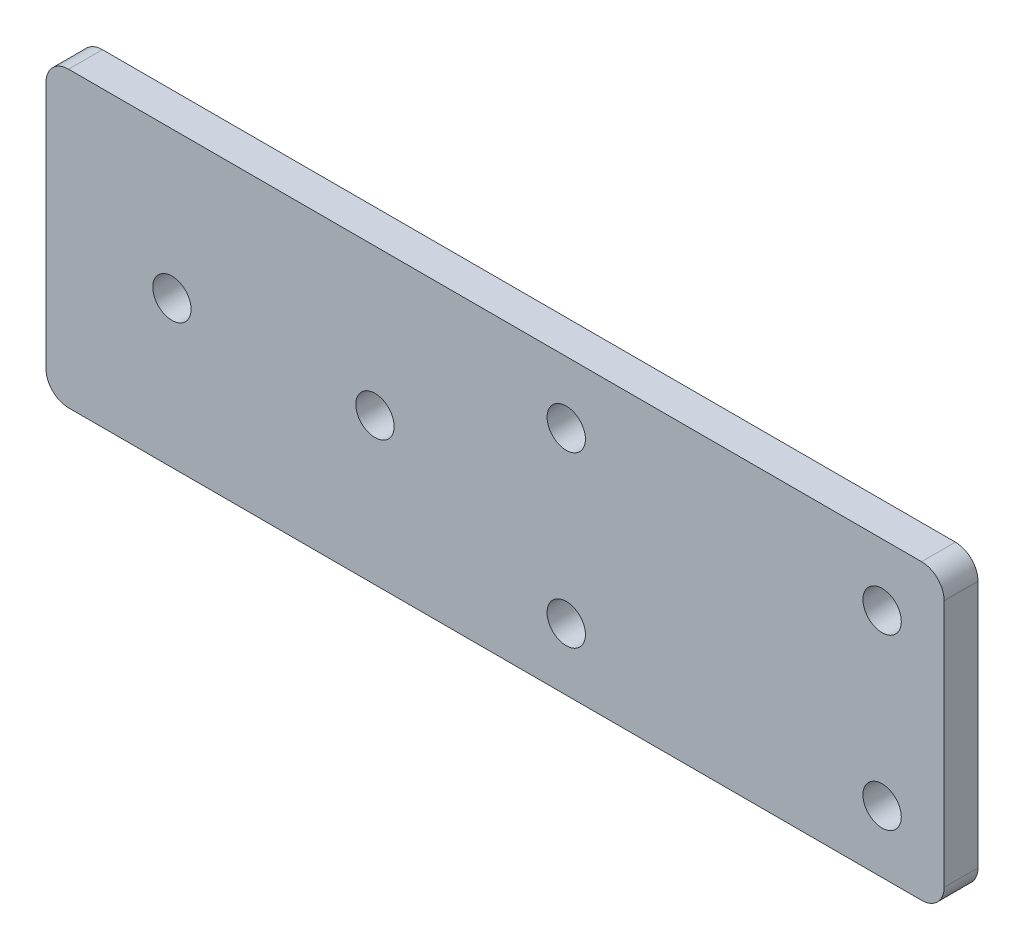
from build123d import *

# Parameters (mm, degrees)
SKETCH1_W                = 79.618258269
SKETCH1_H                = 26
BOSS_EXTRUDE1_DEPTH      = 3
M3_CLEARANCE_HOLE1_D     = 3.4
M3_CLEARANCE_HOLE1_DEPTH = 5
M3_CLEARANCE_HOLE1_TIP   = 1.021463052
M3_CLEARANCE_HOLE2_D     = 3.4
M3_CLEARANCE_HOLE2_DEPTH = 5
M3_CLEARANCE_HOLE2_TIP   = 1.021463052
FILLET1_R                = 2


with BuildPart() as part:
    # Sketch1 → Boss-Extrude1 (new body)
    with BuildSketch(Plane.XY):
        with Locations((337.690870866, 0)):
            Rectangle(SKETCH1_W, SKETCH1_H)
    extrude(amount=BOSS_EXTRUDE1_DEPTH)

    # M3 Clearance Hole1
    with Locations(Plane.XY.offset(3)):
        with Locations((372, -7.5), (372, 7.5), (344, 7.5), (344, -7.5)):
            Hole(M3_CLEARANCE_HOLE1_D / 2, depth=M3_CLEARANCE_HOLE1_DEPTH)
            with Locations((0, 0, -(M3_CLEARANCE_HOLE1_DEPTH + M3_CLEARANCE_HOLE1_TIP / 2))):  # 118° drill point
                Cone(0, M3_CLEARANCE_HOLE1_D / 2, M3_CLEARANCE_HOLE1_TIP, mode=Mode.SUBTRACT)

    # M3 Clearance Hole2
    with Locations(Plane.XY.offset(3)):
        with Locations((309.046054969, 0), (327.046054969, 0)):
            Hole(M3_CLEARANCE_HOLE2_D / 2, depth=M3_CLEARANCE_HOLE2_DEPTH)
            with Locations((0, 0, -(M3_CLEARANCE_HOLE2_DEPTH + M3_CLEARANCE_HOLE2_TIP / 2))):  # 118° drill point
                Cone(0, M3_CLEARANCE_HOLE2_D / 2, M3_CLEARANCE_HOLE2_TIP, mode=Mode.SUBTRACT)

    # Fillet1
    fillet1_edges = [part.edges().sort_by_distance(p)[0] for p in [
        (297.881741731, -13, 1.5),
        (297.881741731, 13, 1.5),
        (377.5, 13, 1.5),
        (377.5, -13, 1.5),
    ]]
    fillet(fillet1_edges, radius=FILLET1_R)


solid = part.part
